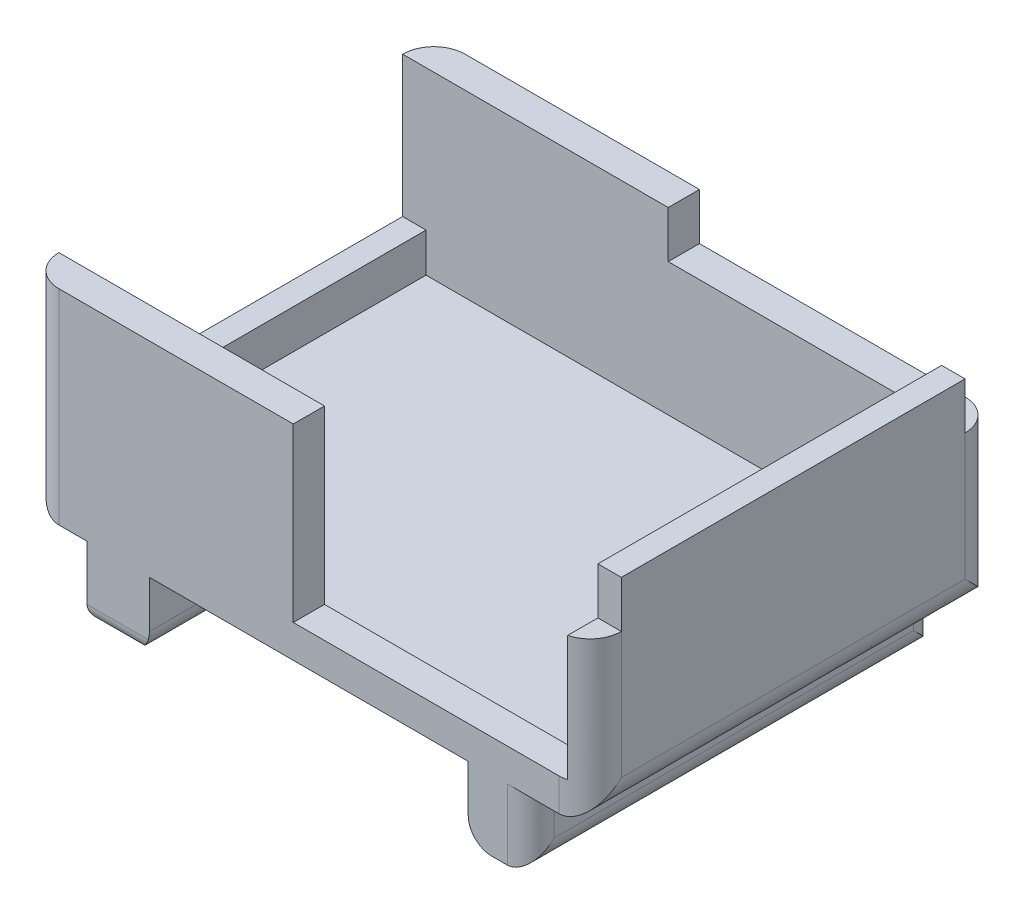
from build123d import *

# Parameters (mm, degrees)
SKETCH_1_W          = 36
SKETCH_1_H          = 26
EXTRUDE_1_DEPTH     = 14.6
SKETCH_2_W          = 33
SKETCH_2_H          = 22
CUT_EXTRUDE_1_DEPTH = 13
SKETCH_3_W          = 36
SKETCH_3_H          = 26
CUT_EXTRUDE_2_DEPTH = 4.5
SKETCH_4_W          = 1.5
SKETCH_4_H          = 22
CUT_EXTRUDE_3_DEPTH = 6
SKETCH_7_W          = 17
SKETCH_7_H          = 2
SKETCH_7_W_2        = 1.5
SKETCH_7_H_2        = 22
EXTRUDE_4_DEPTH     = 3
SKETCH_5_W          = 4
SKETCH_5_H          = 3
EXTRUDE_5_DEPTH     = 2
SKETCH_8_W          = 4
SKETCH_8_H          = 26
EXTRUDE_6_DEPTH     = 2.5
SKETCH_10_W         = 17.5
SKETCH_10_H         = 2
CUT_EXTRUDE_4_DEPTH = 8
FILLET_2_R          = 1
FILLET_3_R          = 1.5
FILLET_4_R          = 1.5
FILLET_5_R          = 1.5
FILLET_6_R          = 2
FILLET_7_R          = 2
FILLET_8_R          = 2
FILLET_START        = -14
FILLET_9_DEPTH      = 28


with BuildPart() as part:
    # 草图1 → 凸台-拉伸1 (new body)
    with BuildSketch(Plane(origin=(0, 0, 0), x_dir=(1, 0, 0), z_dir=(0, 1, 0))):
        Rectangle(SKETCH_1_W, SKETCH_1_H)
    extrude(amount=EXTRUDE_1_DEPTH)

    # 草图2 → 切除-拉伸1 (cut)
    with BuildSketch(Plane(origin=(0, 14.6, 0), x_dir=(1, 0, 0), z_dir=(0, 1, 0))):
        Rectangle(SKETCH_2_W, SKETCH_2_H)
    extrude(amount=-CUT_EXTRUDE_1_DEPTH, mode=Mode.SUBTRACT)

    # 草图3 → 切除-拉伸2 (cut)
    with BuildSketch(Plane(origin=(0, 14.6, 0), x_dir=(1, 0, 0), z_dir=(0, 1, 0))):
        Rectangle(SKETCH_3_W, SKETCH_3_H)
    extrude(amount=-CUT_EXTRUDE_2_DEPTH, mode=Mode.SUBTRACT)

    # 草图4 → 切除-拉伸3 (cut)
    with BuildSketch(Plane(origin=(0, 10.1, 0), x_dir=(1, 0, 0), z_dir=(0, 1, 0))):
        with Locations((-17.25, 0)):
            Rectangle(SKETCH_4_W, SKETCH_4_H)
    extrude(amount=-CUT_EXTRUDE_3_DEPTH, mode=Mode.SUBTRACT)

    # 草图7 → 凸台-拉伸4 (add)
    with BuildSketch(Plane(origin=(0, 10.1, 0), x_dir=(1, 0, 0), z_dir=(0, 1, 0))):
        with Locations((-9.5, 12)):
            Rectangle(SKETCH_7_W, SKETCH_7_H)
        with Locations((-9.5, -12)):
            Rectangle(SKETCH_7_W, SKETCH_7_H)
        with Locations((17.25, 0)):
            Rectangle(SKETCH_7_W_2, SKETCH_7_H_2)
    extrude(amount=EXTRUDE_4_DEPTH)

    # 草图5 → 凸台-拉伸5 (add)
    with BuildSketch(Plane(origin=(0, 0, 0), x_dir=(-1, 0, 0), z_dir=(0, -1, 0))):
        with Locations((-12.2, -11.5)):
            Rectangle(SKETCH_5_W, SKETCH_5_H)
        with Locations((12.2, -11.5)):
            Rectangle(SKETCH_5_W, SKETCH_5_H)
        with Locations((-12.2, 11.5)):
            Rectangle(SKETCH_5_W, SKETCH_5_H)
        with Locations((12.2, 11.5)):
            Rectangle(SKETCH_5_W, SKETCH_5_H)
    extrude(amount=EXTRUDE_5_DEPTH)

    # 草图8 → 凸台-拉伸6 (add)
    with BuildSketch(Plane(origin=(0, -2, 0), x_dir=(-1, 0, 0), z_dir=(0, -1, 0))):
        with Locations((-12.2, 0)):
            Rectangle(SKETCH_8_W, SKETCH_8_H)
        with Locations((12.2, 0)):
            Rectangle(SKETCH_8_W, SKETCH_8_H)
    extrude(amount=EXTRUDE_6_DEPTH)

    # 草图10 → 切除-拉伸4 (cut)
    with BuildSketch(Plane(origin=(0, 10.1, 0), x_dir=(1, 0, 0), z_dir=(0, 1, 0))):
        with Locations((7.75, -12)):
            Rectangle(SKETCH_10_W, SKETCH_10_H)
    extrude(amount=-CUT_EXTRUDE_4_DEPTH, mode=Mode.SUBTRACT)

    # 圆角2
    fillet_2_edges = [part.edges().sort_by_distance(p)[0] for p in [
        (-14.2, -4.5, 0),
        (-12.2, -4.5, -13),
        (-12.2, -4.5, 13),
    ]]
    fillet(fillet_2_edges, radius=FILLET_2_R)

    # 圆角3
    fillet_3_edges = [part.edges().sort_by_distance(p)[0] for p in [
        (14.2, -2.25, 13),
        (14.2, -2.25, -13),
        (14.2, -4.5, 0),
    ]]
    fillet(fillet_3_edges, radius=FILLET_3_R)

    # 圆角4
    fillet_4_edges = [part.edges().sort_by_distance(p)[0] for p in [
        (10.2, -4.5, 0),
    ]]
    fillet(fillet_4_edges, radius=FILLET_4_R)

    # 圆角5
    # the kernel refuses this fillet: 1.5 mm, written as the material it takes off along each edge
    with BuildSketch(Plane(origin=(-10.2, -4.5, 15.75), x_dir=(0, 1, 0), z_dir=(0, 0, -1))) as fillet_5_piece_1:
        with BuildLine():
            CenterArc((FILLET_5_R, -FILLET_5_R), FILLET_5_R, 90, 90)
            Line((0, -FILLET_5_R), (0, 0))
            Line((0, 0), (FILLET_5_R, 0))
        make_face()
    extrude(amount=31.5, mode=Mode.SUBTRACT)

    # 圆角6
    fillet_6_edges = [part.edges().sort_by_distance(p)[0] for p in [
        (-18, 6.55, 13),
        (-18, 6.55, -13),
        (-18, 0, 0),
    ]]
    fillet(fillet_6_edges, radius=FILLET_6_R)

    # 圆角7
    fillet_7_edges = [part.edges().sort_by_distance(p)[0] for p in [
        (18, 5.05, -13),
    ]]
    fillet(fillet_7_edges, radius=FILLET_7_R)

    # 圆角8
    fillet_8_edges = [part.edges().sort_by_distance(p)[0] for p in [
        (18, 5.05, 13),
    ]]
    fillet(fillet_8_edges, radius=FILLET_8_R)

    # 圆角9: read off the stored shape, not the designer's step
    # 圆角9 outline → 圆角9 (cut)
    with BuildSketch(Plane.XY.offset(FILLET_START)):
        with BuildLine():
            Line((18, 0), (18, 2))
            add(Edge.make_bspline(
                [(18, 2), (18, 0), (16, 0)],
                knots=[0, 0, 0, 1, 1, 1], degree=2, weights=[1, 0.707106781, 1]))
            Line((16, 0), (18, 0))
        make_face()
    extrude(amount=FILLET_9_DEPTH, mode=Mode.SUBTRACT)


solid = part.part
